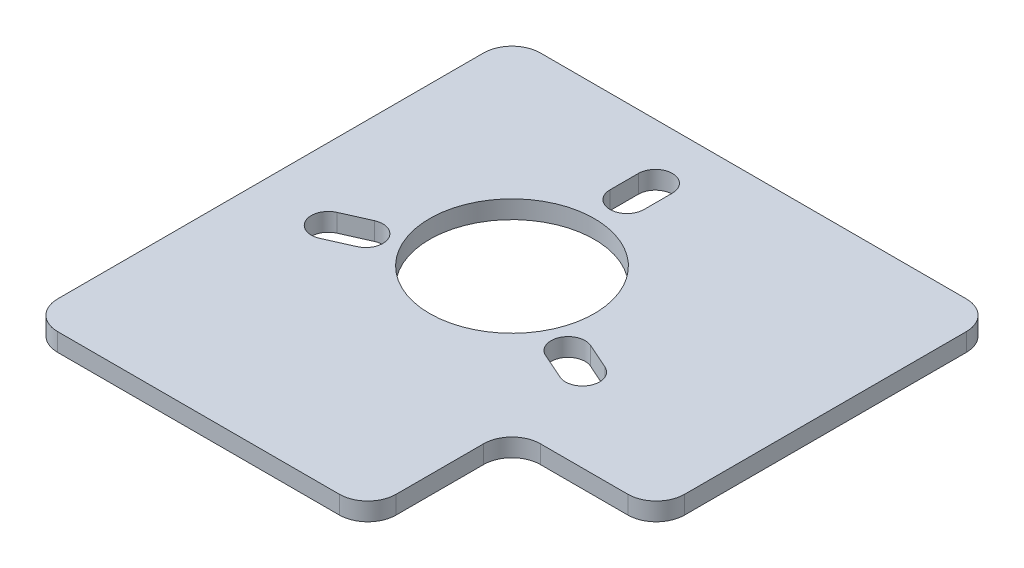
from build123d import *

# Parameters (mm, degrees)
SKETCH1_W           = 170
SKETCH1_H           = 170
SKETCH1_R           = 29
BOSS_EXTRUDE1_DEPTH = 6.35
SKETCH2_W           = 50.8
SKETCH2_H           = 50.8
CUT_EXTRUDE1_DEPTH  = 241.500150728
FILLET1_R           = 10
CUT_EXTRUDE2_DEPTH  = 241.500150728


with BuildPart() as part:
    # Sketch1 → Boss-Extrude1 (new body)
    with BuildSketch(Plane(origin=(0, 0, 0), x_dir=(1, 0, 0), z_dir=(0, 1, 0))):
        with Locations((85, 85)):
            Rectangle(SKETCH1_W, SKETCH1_H)
        with Locations((70, 100)):
            Circle(SKETCH1_R, mode=Mode.SUBTRACT)
    extrude(amount=BOSS_EXTRUDE1_DEPTH)

    # Sketch2 → Cut-Extrude1 (cut, through all)
    with BuildSketch(Plane(origin=(0, 6.35, 0), x_dir=(1, 0, 0), z_dir=(0, 1, 0))):
        with Locations((144.6, 25.4)):
            Rectangle(SKETCH2_W, SKETCH2_H)
    extrude(amount=-CUT_EXTRUDE1_DEPTH, mode=Mode.SUBTRACT)

    # Fillet1
    fillet1_edges = [part.edges().sort_by_distance(p)[0] for p in [
        (170, 3.175, -170),
        (0, 3.175, -170),
        (119.2, 3.175, -50.8),
        (119.2, 3.175, 0),
        (170, 3.175, -50.8),
        (0, 3.175, 0),
    ]]
    fillet(fillet1_edges, radius=FILLET1_R)

    # Sketch3 → Cut-Extrude2 (cut, through all)
    with BuildSketch(Plane(origin=(0, 6.35, 0), x_dir=(1, 0, 0), z_dir=(0, 1, 0))):
        with BuildLine():
            Line((22.795852717, 85.551177235), (31.931307293, 89.618543666))
            ThreePointArc((31.931307293, 89.618543666), (39.852999898, 86.577690778), (36.81214701, 78.655998174))
            Line((36.81214701, 78.655998174), (27.676692434, 74.588631743))
            ThreePointArc((27.676692434, 74.588631743), (19.75499983, 77.629484631), (22.795852717, 85.551177235))
        make_face()
        with BuildLine():
            Line((112.323307566, 74.588631743), (103.18785299, 78.655998174))
            ThreePointArc((103.18785299, 78.655998174), (100.147000102, 86.577690778), (108.068692707, 89.618543666))
            Line((108.068692707, 89.618543666), (117.204147283, 85.551177235))
            ThreePointArc((117.204147283, 85.551177235), (120.24500017, 77.629484631), (112.323307566, 74.588631743))
        make_face()
        with BuildLine():
            Line((76, 150.5), (76, 140.5))
            ThreePointArc((76, 140.5), (70, 134.5), (64, 140.5))
            Line((64, 140.5), (64, 150.5))
            ThreePointArc((64, 150.5), (70, 156.5), (76, 150.5))
        make_face()
    extrude(amount=-CUT_EXTRUDE2_DEPTH, mode=Mode.SUBTRACT)


solid = part.part
